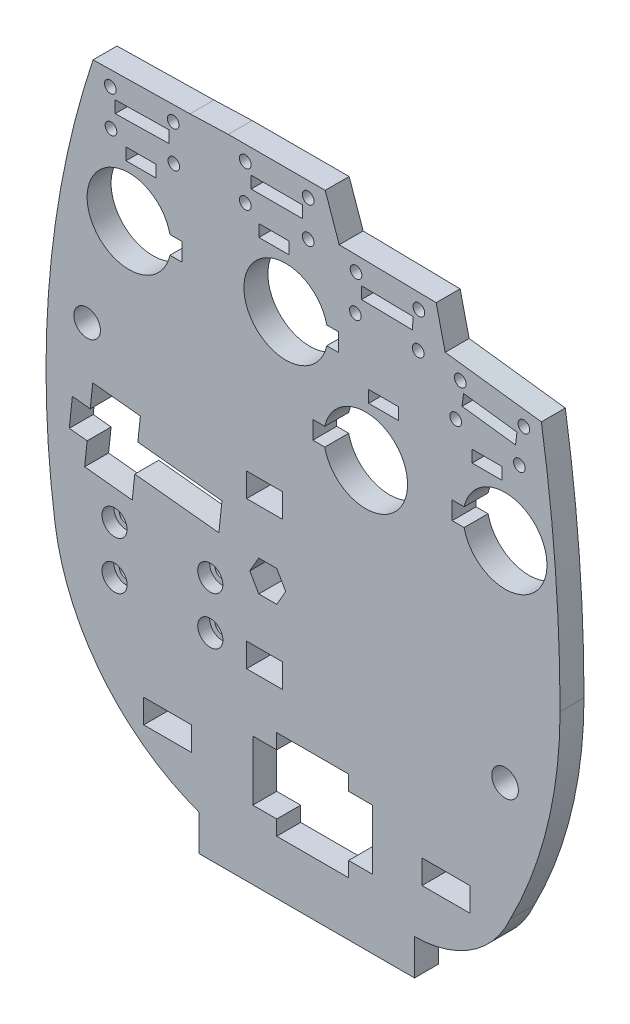
from build123d import *

# Parameters (mm, degrees)
SKETCH1_R           = 2.225
SKETCH1_R_2         = 1.225
SKETCH1_R_3         = 0.975
SKETCH1_W           = 8.55
SKETCH1_H           = 2
SKETCH1_W_2         = 5
SKETCH1_W_3         = 6.000000352
SKETCH1_H_2         = 4
BOSS_EXTRUDE1_DEPTH = 4
SKETCH2_R           = 2.1
CUT_EXTRUDE1_DEPTH  = 2
SKETCH3_W           = 8
SKETCH3_H           = 4
CUT_EXTRUDE2_DEPTH  = 96.207900268


with BuildPart() as part:
    # Sketch1 → Boss-Extrude1 (new body)
    with BuildSketch(Plane.XY):
        with BuildLine():
            Line((-12.978641063, -17.999999648), (-12.978641063, -24))
            Line((-12.978641063, -24), (23.021361236, -24))
            Line((23.021361236, -24), (23.021361236, -17.999999648))
            ThreePointArc((23.021361236, -17.999999648), (32.577630228, -15.139859344), (38.991305368, -7.5))
            ThreePointArc((38.991305368, -7.5), (45.219254131, 9.097839331), (47.3354431, 26.698900677))
            ThreePointArc((47.3354431, 26.698900677), (46.554459277, 46.942107237), (44.216150624, 67.064971353))
            Line((44.216150624, 67.064971353), (28.143849376, 69.095028647))
            Line((28.143849376, 69.095028647), (26.638766331, 75.523635508))
            Line((26.638766331, 75.523635508), (10.441233669, 75.806364492))
            Line((10.441233669, 75.806364492), (8.1, 82.51))
            Line((8.1, 82.51), (-8.1, 82.51))
            Line((-8.1, 82.51), (-14.491235706, 82.281481113))
            Line((-14.491235706, 82.281481113), (-30.688764294, 81.998518887))
            ThreePointArc((-30.688764294, 81.998518887), (-37.914532987, 47.276776451), (-37.052658257, 11.821617405))
            ThreePointArc((-37.052658257, 11.821617405), (-29.143237496, -6.421257936), (-12.978641063, -17.999999648))
        make_face()
        with Locations((38.147341743, 11.821617405)):
            Circle(SKETCH1_R, mode=Mode.SUBTRACT)
        with Locations((-27.1, 8.875641236)):
            Circle(SKETCH1_R_2, mode=Mode.SUBTRACT)
        with Locations((-27.1, 16.875641236)):
            Circle(SKETCH1_R_2, mode=Mode.SUBTRACT)
        with Locations((-11.1, 8.875641236)):
            Circle(SKETCH1_R_2, mode=Mode.SUBTRACT)
        with Locations((-11.1, 16.875641236)):
            Circle(SKETCH1_R_2, mode=Mode.SUBTRACT)
        with Locations((-5.25, 80.01)):
            Circle(SKETCH1_R_3, mode=Mode.SUBTRACT)
        with Locations((30.658103408, 66.257595536)):
            Circle(SKETCH1_R_3, mode=Mode.SUBTRACT)
        with Locations((-31.681501662, 43.456405989)):
            Circle(SKETCH1_R, mode=Mode.SUBTRACT)
        with Locations((5.25, 80.01)):
            Circle(SKETCH1_R_3, mode=Mode.SUBTRACT)
        with Locations((5.25, 74.01)):
            Circle(SKETCH1_R_3, mode=Mode.SUBTRACT)
        with Locations((-5.25, 74.01)):
            Circle(SKETCH1_R_3, mode=Mode.SUBTRACT)
        with Locations((-27.795567347, 79.548639007)):
            Circle(SKETCH1_R_3, mode=Mode.SUBTRACT)
        with Locations((-17.297097199, 79.732041708)):
            Circle(SKETCH1_R_3, mode=Mode.SUBTRACT)
        with Locations((-27.690766522, 73.549554345)):
            Circle(SKETCH1_R_3, mode=Mode.SUBTRACT)
        with Locations((-17.192296374, 73.732957046)):
            Circle(SKETCH1_R_3, mode=Mode.SUBTRACT)
        with Locations((23.640854945, 67.074669457)):
            Circle(SKETCH1_R_3, mode=Mode.SUBTRACT)
        with Locations((13.142454146, 67.257919725)):
            Circle(SKETCH1_R_3, mode=Mode.SUBTRACT)
        with Locations((23.745569383, 73.073755628)):
            Circle(SKETCH1_R_3, mode=Mode.SUBTRACT)
        with Locations((13.247168584, 73.257005896)):
            Circle(SKETCH1_R_3, mode=Mode.SUBTRACT)
        with Locations((29.906230336, 60.30489137)):
            Circle(SKETCH1_R_3, mode=Mode.SUBTRACT)
        with Locations((41.298919267, 64.913577307)):
            Circle(SKETCH1_R_3, mode=Mode.SUBTRACT)
        with Locations((40.547046195, 58.960873141)):
            Circle(SKETCH1_R_3, mode=Mode.SUBTRACT)
        with Locations((0, 77.51)):
            Rectangle(SKETCH1_W, SKETCH1_H, mode=Mode.SUBTRACT)
        Polygon((-9.666, 24.072257636), (-9.153, 28.953126601), (-23.204098338, 30.429956546), (-22.785984485, 34.408044128), (-30.742159647, 35.244271834), (-31.160273501, 31.266184253), (-34.143839187, 31.579769642), (-34.656839187, 26.698900677), (-31.673273501, 26.385315288), (-32.091387354, 22.407227706), (-24.135212191, 21.571), (-23.717098338, 25.549087581), align=None, mode=Mode.SUBTRACT)
        with BuildLine():
            Line((10.358817838, 63.151218734), (10.358817838, 60.151218734))
            Line((10.358817838, 60.151218734), (8.358817838, 60.151218734))
            ThreePointArc((8.358817838, 60.151218734), (-5.478579327, 61.651218734), (8.358817838, 63.151218734))
            Line((8.358817838, 63.151218734), (10.358817838, 63.151218734))
        make_face(mode=Mode.SUBTRACT)
        with Locations((35.147341743, 56.321617405)):
            Rectangle(SKETCH1_W_2, SKETCH1_H, mode=Mode.SUBTRACT)
        with BuildLine():
            Line((-17.84156291, 63.151218734), (-15.84156291, 63.151218734))
            Line((-15.84156291, 63.151218734), (-15.84156291, 60.151218734))
            Line((-15.84156291, 60.151218734), (-17.84156291, 60.151218734))
            ThreePointArc((-17.84156291, 60.151218734), (-31.678960076, 61.651218734), (-17.84156291, 63.151218734))
        make_face(mode=Mode.SUBTRACT)
        Polygon((-27.019482275, 78.062008978), (-18.020783292, 78.219211472), (-17.985849684, 76.219516585), (-26.984548667, 76.06231409), align=None, mode=Mode.SUBTRACT)
        with Locations((17.86306514, 56.321617405)):
            Rectangle(SKETCH1_W_2, SKETCH1_H, mode=Mode.SUBTRACT)
        with Locations((-0.478579327, 71.151218734)):
            Rectangle(SKETCH1_W_2, SKETCH1_H, mode=Mode.SUBTRACT)
        Polygon((14.195841477, 71.740218257), (14.160936665, 69.740522867), (22.709634458, 69.591304792), (22.744539271, 71.591000182), align=None, mode=Mode.SUBTRACT)
        with BuildLine():
            Line((8.025667975, 48.321617405), (6.025667975, 48.321617405))
            Line((6.025667975, 48.321617405), (6.025667975, 45.321617405))
            Line((6.025667975, 45.321617405), (8.025667975, 45.321617405))
            ThreePointArc((8.025667975, 45.321617405), (21.86306514, 46.821617405), (8.025667975, 48.321617405))
        make_face(mode=Mode.SUBTRACT)
        Polygon((40.143636572, 63.54758064), (31.213865999, 64.675480473), (30.963241642, 62.691245751), (39.893012214, 61.563345918), align=None, mode=Mode.SUBTRACT)
        with BuildLine():
            Line((29.309944577, 45.321617405), (31.309944577, 45.321617405))
            ThreePointArc((31.309944577, 45.321617405), (45.147341743, 46.821617405), (31.309944577, 48.321617405))
            Line((31.309944577, 48.321617405), (29.309944577, 48.321617405))
            Line((29.309944577, 48.321617405), (29.309944577, 45.321617405))
        make_face(mode=Mode.SUBTRACT)
        with Locations((-22.678960076, 71.151218734)):
            Rectangle(SKETCH1_W_2, SKETCH1_H, mode=Mode.SUBTRACT)
        Polygon((-4, -2.5), (0, -2.5), (0, 0), (12, 0), (12, -2.5), (16, -2.5), (16, -12.5), (12, -12.5), (12, -15), (0, -15), (0, -12.5), (-4, -12.5), align=None, mode=Mode.SUBTRACT)
        Polygon((0, 23.754659123), (-3, 23.754659123), (-4.5, 21.156582912), (-3, 18.5585067), (0, 18.5585067), (1.5, 21.156582912), align=None, mode=Mode.SUBTRACT)
        with Locations((-2.036620161, 8.717005814)):
            Rectangle(SKETCH1_W_3, SKETCH1_H_2, mode=Mode.SUBTRACT)
        with Locations((-2.036620161, 33.335566927)):
            Rectangle(SKETCH1_W_3, SKETCH1_H_2, mode=Mode.SUBTRACT)
    extrude(amount=BOSS_EXTRUDE1_DEPTH)

    # Sketch2 → Cut-Extrude1 (cut)
    with BuildSketch(Plane.XY.offset(4)):
        with Locations((-11.1, 16.875641236)):
            Circle(SKETCH2_R)
        with Locations((-11.1, 8.875641236)):
            Circle(SKETCH2_R)
        with Locations((-27.1, 8.875641236)):
            Circle(SKETCH2_R)
        with Locations((-27.1, 16.875641236)):
            Circle(SKETCH2_R)
    extrude(amount=-CUT_EXTRUDE1_DEPTH, mode=Mode.SUBTRACT)

    # Sketch3 → Cut-Extrude2 (cut, through all)
    with BuildSketch(Plane(origin=(0, 0, 0), x_dir=(-1, 0, 0), z_dir=(0, 0, -1))):
        with Locations((-28.271360086, -8)):
            Rectangle(SKETCH3_W, SKETCH3_H)
        with Locations((18.228639914, -8)):
            Rectangle(SKETCH3_W, SKETCH3_H)
    extrude(amount=-CUT_EXTRUDE2_DEPTH, mode=Mode.SUBTRACT)


solid = part.part
